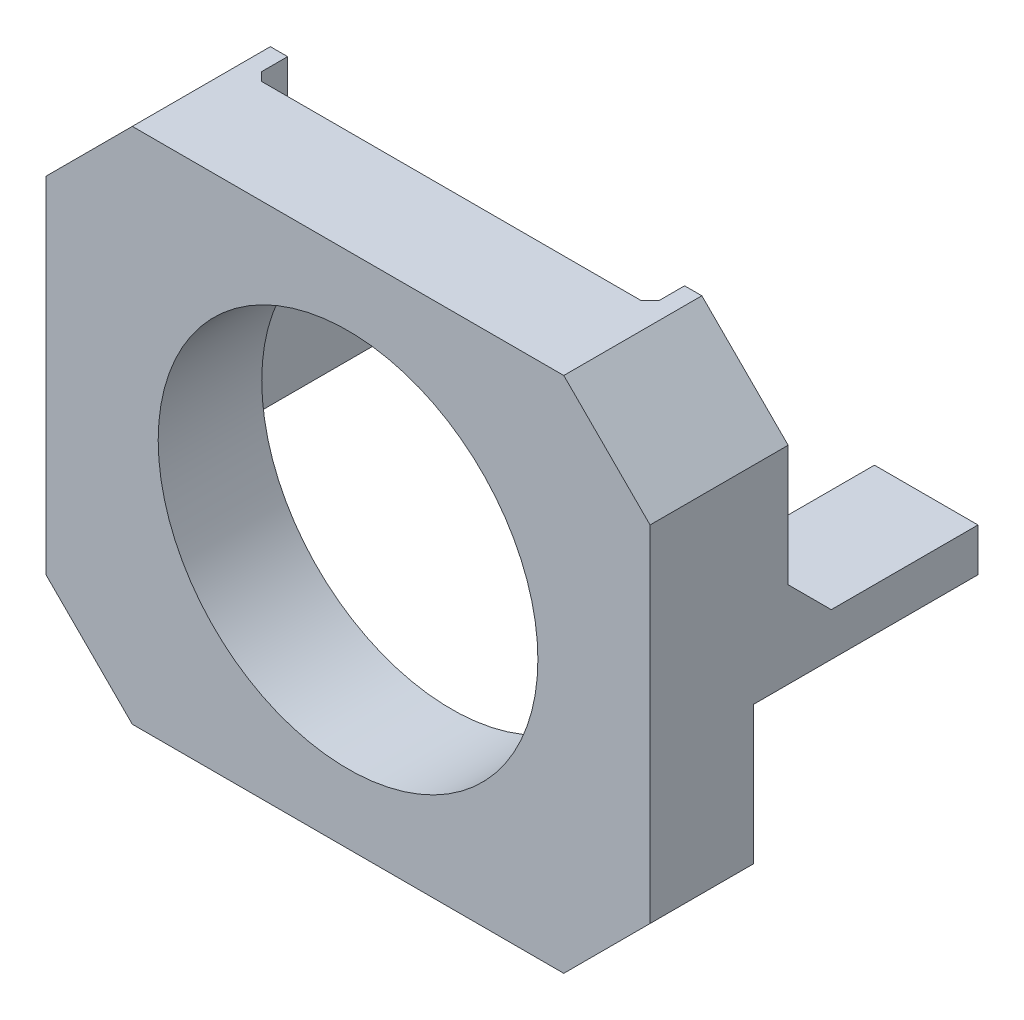
from build123d import *

# Parameters (mm, degrees)
SKETCH1_W           = 35
SKETCH1_H           = 30
SKETCH1_R           = 11
BOSS_EXTRUDE1_DEPTH = 6
SKETCH2_W           = 6
SKETCH2_H           = 17
BOSS_EXTRUDE2_DEPTH = 2
SKETCH3_W           = 6
SKETCH3_H           = 2.5
BOSS_EXTRUDE3_DEPTH = 11
CHAMFER1_SIZE       = 5
CHAMFER2_SIZE       = 2.5
CHAMFER3_SIZE       = 0.5


with BuildPart() as part:
    # Sketch1 → Boss-Extrude1 (new body)
    with BuildSketch(Plane.XY):
        Rectangle(SKETCH1_W, SKETCH1_H)
        Circle(SKETCH1_R, mode=Mode.SUBTRACT)
    extrude(amount=BOSS_EXTRUDE1_DEPTH)

    # Sketch2 → Boss-Extrude2 (add)
    with BuildSketch(Plane(origin=(0, 0, 0), x_dir=(-1, 0, 0), z_dir=(0, 0, -1))):
        with Locations((14.5, 6.5)):
            Rectangle(SKETCH2_W, SKETCH2_H)
        with Locations((-14.5, 6.5)):
            Rectangle(SKETCH2_W, SKETCH2_H)
    extrude(amount=BOSS_EXTRUDE2_DEPTH)

    # Sketch3 → Boss-Extrude3 (add)
    with BuildSketch(Plane(origin=(0, 0, -2), x_dir=(-1, 0, 0), z_dir=(0, 0, -1))):
        with Locations((14.5, -0.75)):
            Rectangle(SKETCH3_W, SKETCH3_H)
        with Locations((-14.5, -0.75)):
            Rectangle(SKETCH3_W, SKETCH3_H)
    extrude(amount=BOSS_EXTRUDE3_DEPTH)

    # Chamfer1
    chamfer1_edges = [part.edges().sort_by_distance(p)[0] for p in [
        (17.5, -15, 3),
        (-17.5, -15, 3),
        (-17.5, 15, 2),
        (17.5, 15, 2),
    ]]
    chamfer(chamfer1_edges, length=CHAMFER1_SIZE)

    # Chamfer2
    chamfer2_edges = [part.edges().sort_by_distance(p)[0] for p in [
        (-14.5, 0.5, -2),
        (14.5, 0.5, -2),
    ]]
    chamfer(chamfer2_edges, length=CHAMFER2_SIZE)

    # Chamfer3
    chamfer3_edges = [part.edges().sort_by_distance(p)[0] for p in [
        (-11.5, 6.5, 0),
        (11.5, 6.5, 0),
    ]]
    chamfer(chamfer3_edges, length=CHAMFER3_SIZE - 0.0001)  # a hair under: the kernel refuses the full size


solid = part.part
